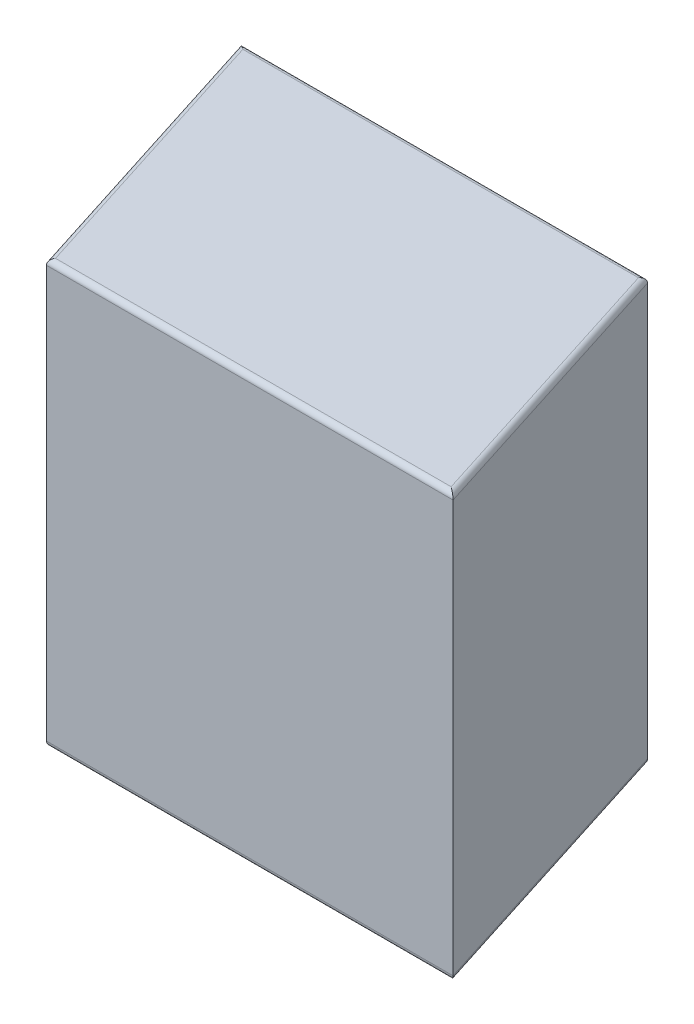
from build123d import *

# Parameters (mm, degrees)
BOSS_EXTRUDE1_DEPTH = 40
FILLET1_R           = 0.5


with BuildPart() as part:
    # Sketch1 → Boss-Extrude1 (new body)
    with BuildSketch(Plane(origin=(0, 0, 0), x_dir=(1, 0, 0), z_dir=(0, 1, 0))):
        Polygon((0, 0), (38.5, 0), (29.914344547, 27), (-8.585655453, 27), align=None)
    extrude(amount=BOSS_EXTRUDE1_DEPTH)

    # Fillet1
    fillet1_edges = [part.edges().sort_by_distance(p)[0] for p in [
        (19.25, 0, 0),
        (34.207172274, 0, -13.5),
        (10.664344547, 0, -27),
        (-4.292827726, 0, -13.5),
        (10.664344547, 40, -27),
        (34.207172274, 40, -13.5),
        (19.25, 40, 0),
        (-4.292827726, 40, -13.5),
    ]]
    fillet(fillet1_edges, radius=FILLET1_R)


solid = part.part
